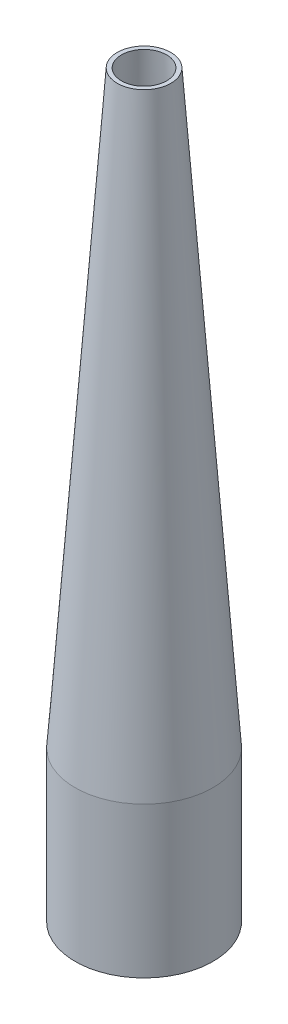
from build123d import *


# Read off the part's stored shape, not the designer's step: Shell1
with BuildPart() as part:
    # Sketch1 → Revolve2 (revolve)
    with BuildSketch(Plane.XY, mode=Mode.PRIVATE) as revolve2_sk:
        Polygon((29.083, 0), (29.083, 63.5), (11.303, 311.954148472), (0, 311.954148472), (0, 0), align=None)
    revolve(revolve2_sk.sketch.rotate(Axis((0, -23.495, 0), (0, 1, 0)), 90), axis=Axis((0, -23.495, 0), (0, 1, 0)))

    # Shell1 outline → Shell1 (revolve, cut)
    with BuildSketch(Plane.XY):
        Polygon((27.305, 0), (27.305, 63.436462181), (9.520453075, 311.954148472), (0, 311.954148472), (0, 0), align=None)
    revolve(axis=Axis((0, 0, 0), (0, 1, 0)), mode=Mode.SUBTRACT)


solid = part.part
